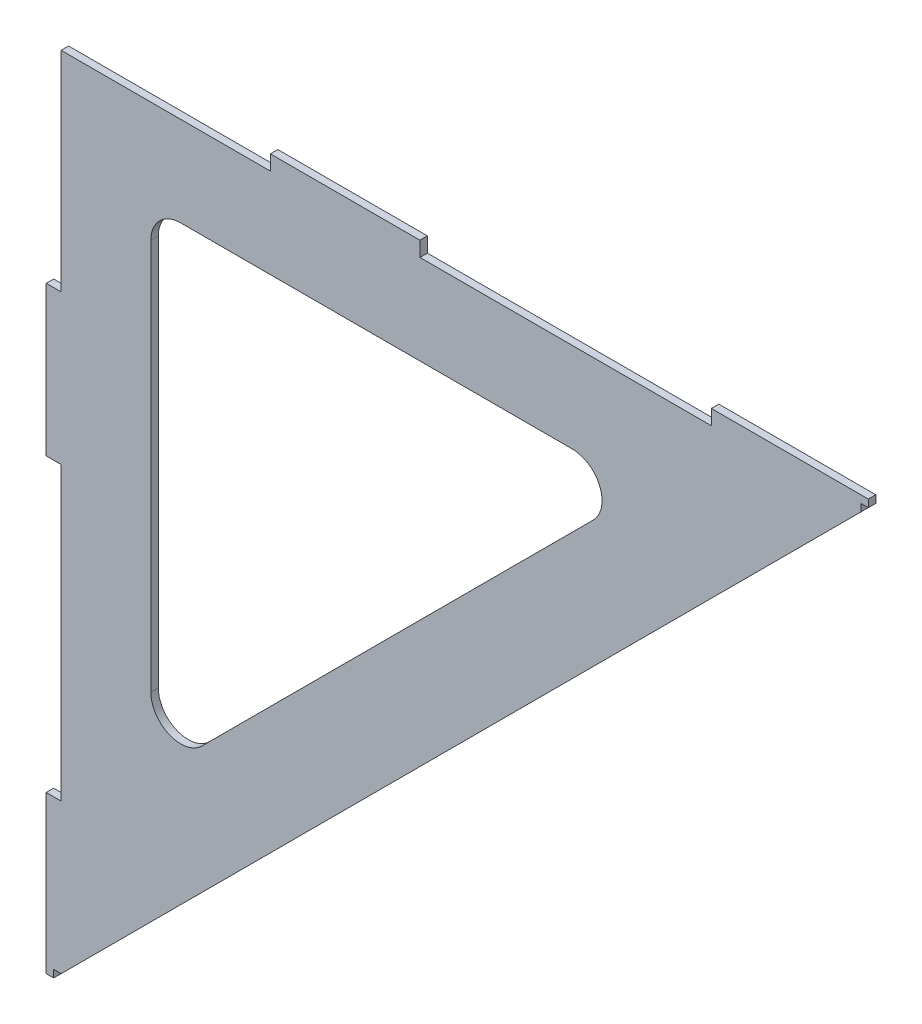
from build123d import *

# Parameters (mm, degrees)
BOSS_EXTRUDE1_DEPTH = 2.5


with BuildPart() as part:
    # Sketch1 → Boss-Extrude1 (new body)
    with BuildSketch(Plane.XY):
        Polygon((-132.5, 132.5), (-132.5, 62.5), (-137.5, 62.5), (-137.5, 12.5), (-132.5, 12.5), (-132.5, -85), (-137.5, -85), (-137.5, -137.5), (-135, -137.5), (-135, -135), (-132.5, -135), (135, 132.5), (135, 135), (137.5, 135), (137.5, 137.5), (85, 137.5), (85, 132.5), (-12.5, 132.5), (-12.5, 137.5), (-62.5, 137.5), (-62.5, 132.5), align=None)
        with BuildLine():
            Line((-92.5, 102.5), (38.431457505, 102.5))
            ThreePointArc((38.431457505, 102.5), (47.67025283, 96.326834324), (45.502525317, 85.428932188))
            Line((45.502525317, 85.428932188), (-85.428932188, -45.502525317))
            ThreePointArc((-85.428932188, -45.502525317), (-96.326834324, -47.67025283), (-102.5, -38.431457505))
            Line((-102.5, -38.431457505), (-102.5, 92.5))
            ThreePointArc((-102.5, 92.5), (-99.571067812, 99.571067812), (-92.5, 102.5))
        make_face(mode=Mode.SUBTRACT)
    extrude(amount=BOSS_EXTRUDE1_DEPTH)


solid = part.part
